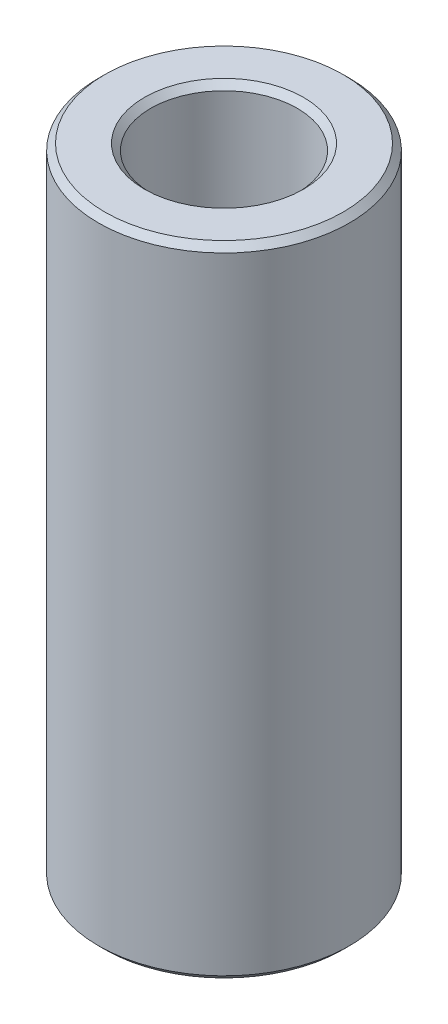
from build123d import *

# Parameters (mm, degrees)
SKETCH1_R           = 37.5
BOSS_EXTRUDE1_DEPTH = 190.873743783
SKETCH2_R           = 21.901030846
CUT_EXTRUDE1_DEPTH  = 199.104230308
CHAMFER1_SIZE       = 1.884859283


with BuildPart() as part:
    # Sketch1 → Boss-Extrude1 (new body)
    with BuildSketch(Plane(origin=(0, 0, 0), x_dir=(1, 0, 0), z_dir=(0, 1, 0))):
        Circle(SKETCH1_R)
    extrude(amount=BOSS_EXTRUDE1_DEPTH)

    # Sketch2 → Cut-Extrude1 (cut, through all)
    with BuildSketch(Plane(origin=(0, 0, 0), x_dir=(1, 0, 0), z_dir=(0, 1, 0))):
        Circle(SKETCH2_R)
    extrude(amount=CUT_EXTRUDE1_DEPTH, mode=Mode.SUBTRACT)

    # Chamfer1
    chamfer1_edges = [part.edges().sort_by_distance(p)[0] for p in [
        (-21.901030846, 190.873743783, 0),
        (-21.901030846, 0, 0),
        (-37.5, 0, 0),
        (-37.5, 190.873743783, 0),
    ]]
    chamfer(chamfer1_edges, length=CHAMFER1_SIZE)


solid = part.part
